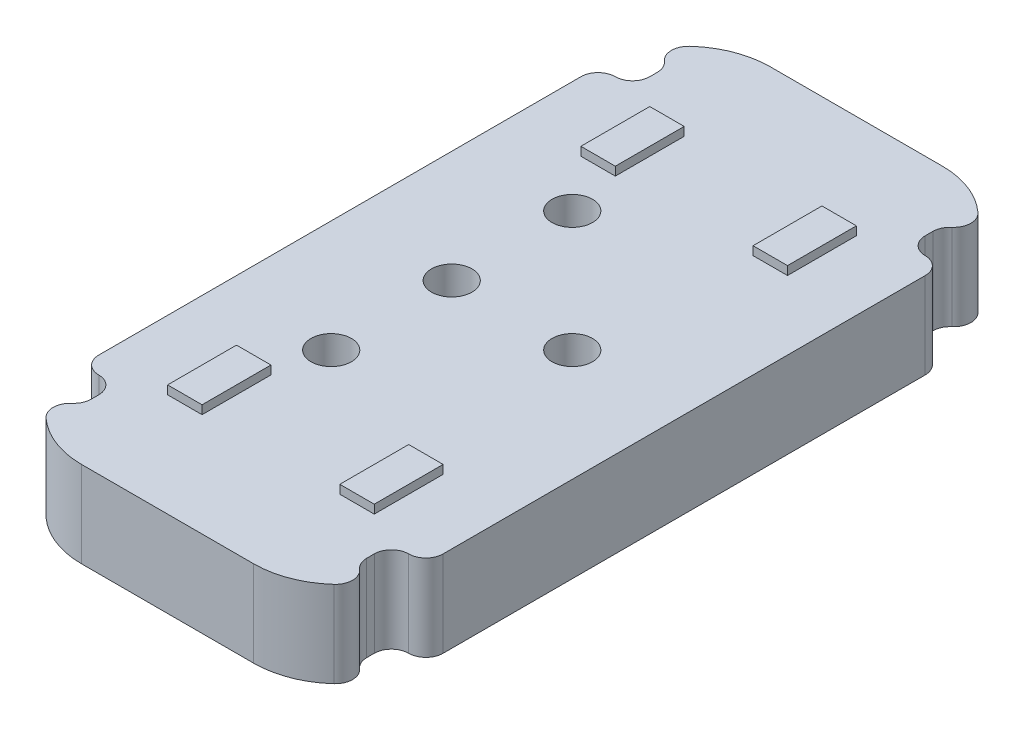
from build123d import *

# Parameters (mm, degrees)
SKETCH1_W            = 20
SKETCH1_H            = 40
SKETCH1_R            = 1.175
BOSS_EXTRUDE1_DEPTH  = 5
FILLET1_R            = 5
SKETCH2_W            = 2
SKETCH2_H            = 4
BOSS_EXTRUDE2_DEPTH  = 0.5
LPATTERN1_COUNT      = 2
LPATTERN1_PITCH      = 10
LPATTERN1_COUNT_DIR2 = 2
LPATTERN1_PITCH_DIR2 = 24
CUT_EXTRUDE1_DEPTH   = 25.748737342
FILLET2_R            = 1


with BuildPart() as part:
    # Sketch1 → Boss-Extrude1 (new body)
    with BuildSketch(Plane(origin=(0, 0, 0), x_dir=(1, 0, 0), z_dir=(0, 1, 0))):
        with Locations((3.5, 0)):
            Rectangle(SKETCH1_W, SKETCH1_H)
        with Locations(Location((0, 0, 0), (0, 0, 270))):
            Circle(SKETCH1_R, mode=Mode.SUBTRACT)
        with Locations(Location((0, 7, 0), (0, 0, 270))):
            Circle(SKETCH1_R, mode=Mode.SUBTRACT)
        with Locations(Location((7, 0, 0), (0, 0, 270))):
            Circle(SKETCH1_R, mode=Mode.SUBTRACT)
        with Locations(Location((0, -7, 0), (0, 0, 270))):
            Circle(SKETCH1_R, mode=Mode.SUBTRACT)
    extrude(amount=BOSS_EXTRUDE1_DEPTH)

    # Fillet1
    fillet1_edges = [part.edges().sort_by_distance(p)[0] for p in [
        (-6.5, 2.5, -20),
        (13.5, 2.5, -20),
        (13.5, 2.5, 20),
        (-6.5, 2.5, 20),
    ]]
    fillet(fillet1_edges, radius=FILLET1_R)

    # Sketch2 → Boss-Extrude2 (add)
    with BuildSketch(Plane(origin=(0, 5, 0), x_dir=(1, 0, 0), z_dir=(0, 1, 0))):
        with Locations((-1.5, 12)):
            Rectangle(SKETCH2_W, SKETCH2_H)
    boss_extrude2 = extrude(amount=BOSS_EXTRUDE2_DEPTH)

    # LPattern1: Boss-Extrude2 2 × 2
    with Locations(*[(i * LPATTERN1_PITCH, 0, j * LPATTERN1_PITCH_DIR2) for i in range(LPATTERN1_COUNT) for j in range(LPATTERN1_COUNT_DIR2) if (i, j) != (0, 0)]):
        add(boss_extrude2)

    # Sketch4 → Cut-Extrude1 (cut, through all)
    with BuildSketch(Plane.XZ):
        with BuildLine():
            Line((-7.54955844, 17.440393275), (-5.5, 17.440393275))
            ThreePointArc((-5.5, 17.440393275), (-4.792893219, 17.147500056), (-4.5, 16.440393275))
            Line((-4.5, 16.440393275), (-4.5, 16))
            ThreePointArc((-4.5, 16), (-4.792893219, 15.292893219), (-5.5, 15))
            Line((-5.5, 15), (-7.54955844, 15))
            Line((-7.54955844, 15), (-7.54955844, 17.440393275))
        make_face()
        with BuildLine():
            Line((14.54955844, 17.440393275), (14.54955844, 15))
            Line((14.54955844, 15), (12.5, 15))
            ThreePointArc((12.5, 15), (11.792893219, 15.292893219), (11.5, 16))
            Line((11.5, 16), (11.5, 16.440393275))
            ThreePointArc((11.5, 16.440393275), (11.792893219, 17.147500056), (12.5, 17.440393275))
            Line((12.5, 17.440393275), (14.54955844, 17.440393275))
        make_face()
        with BuildLine():
            Line((14.54955844, -17.440393275), (12.5, -17.440393275))
            ThreePointArc((12.5, -17.440393275), (11.792893219, -17.147500056), (11.5, -16.440393275))
            Line((11.5, -16.440393275), (11.5, -16))
            ThreePointArc((11.5, -16), (11.792893219, -15.292893219), (12.5, -15))
            Line((12.5, -15), (14.54955844, -15))
            Line((14.54955844, -15), (14.54955844, -17.440393275))
        make_face()
        with BuildLine():
            Line((-4.5, -16.440393275), (-4.5, -16))
            ThreePointArc((-4.5, -16), (-4.792893219, -15.292893219), (-5.5, -15))
            Line((-5.5, -15), (-7.54955844, -15))
            Line((-7.54955844, -15), (-7.54955844, -17.440393275))
            Line((-7.54955844, -17.440393275), (-5.5, -17.440393275))
            ThreePointArc((-5.5, -17.440393275), (-4.792893219, -17.147500056), (-4.5, -16.440393275))
        make_face()
    extrude(amount=-CUT_EXTRUDE1_DEPTH, mode=Mode.SUBTRACT)

    # Fillet2
    fillet2_edges = [part.edges().sort_by_distance(p)[0] for p in [
        (12.863998243, 2.5, -17.440393275),
        (13.5, 2.5, -15),
        (-5.863998243, 2.5, -17.440393275),
        (-6.5, 2.5, -15),
        (13.5, 2.5, 15),
        (12.863998243, 2.5, 17.440393275),
        (-6.5, 2.5, 15),
        (-5.863998243, 2.5, 17.440393275),
    ]]
    fillet(fillet2_edges, radius=FILLET2_R - 0.0001)  # a hair under: the kernel refuses the full size


solid = part.part
